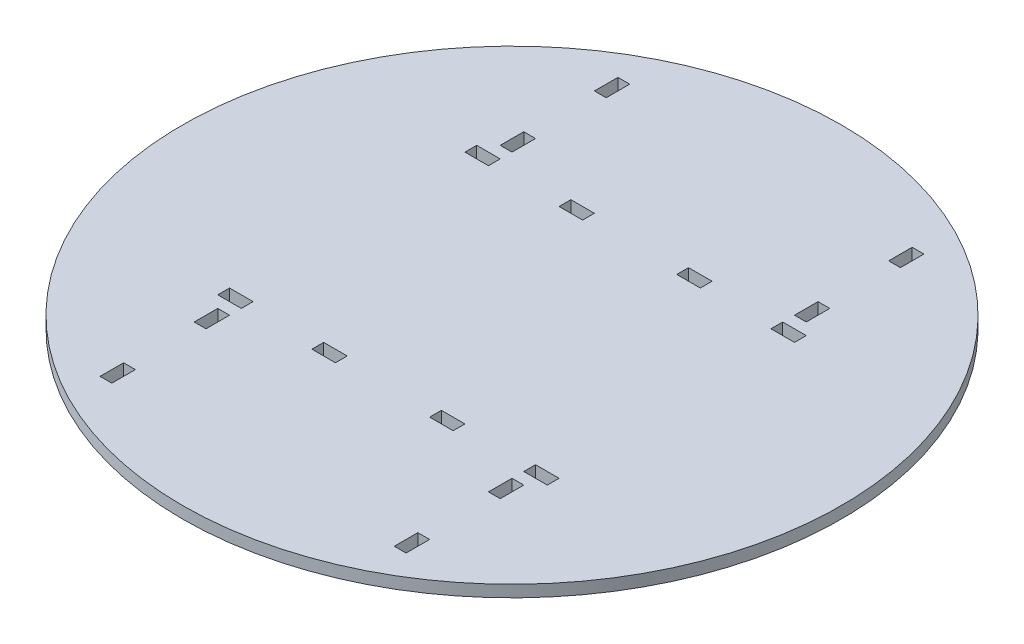
from build123d import *

# Parameters (mm, degrees)
SKETCH1_W           = 6.35
SKETCH1_H           = 12.7
SKETCH1_W_2         = 12.7
SKETCH1_H_2         = 6.35
BOSS_EXTRUDE1_DEPTH = 6.35


with BuildPart() as part:
    # Sketch1 → Boss-Extrude1 (new body)
    # profile 1 of 4: a face of its own
    with BuildSketch(Plane(origin=(0, 0, 0), x_dir=(1, 0, 0), z_dir=(0, 1, 0))):
        with BuildLine():
            Line((0, -177.8), (0, 0))
            Line((0, 0), (-177.8, 0))
            ThreePointArc((-177.8, 0), (-125.723585695, -125.723585695), (0, -177.8))
        make_face()
        with Locations((-79.375, -133.35)):
            Rectangle(SKETCH1_W, SKETCH1_H, mode=Mode.SUBTRACT)
        with Locations((-79.375, -82.55)):
            Rectangle(SKETCH1_W, SKETCH1_H, mode=Mode.SUBTRACT)
        with Locations((-82.55, -66.675)):
            Rectangle(SKETCH1_W_2, SKETCH1_H_2, mode=Mode.SUBTRACT)
        with Locations((-31.75, -66.675)):
            Rectangle(SKETCH1_W_2, SKETCH1_H_2, mode=Mode.SUBTRACT)
    # profile 2 of 4: a face of its own
    with BuildSketch(Plane(origin=(0, 0, 0), x_dir=(1, 0, 0), z_dir=(0, 1, 0))):
        with BuildLine():
            Line((177.8, 0), (0, 0))
            Line((0, 0), (0, -177.8))
            ThreePointArc((0, -177.8), (125.723585695, -125.723585695), (177.8, 0))
        make_face()
        with Locations((79.375, -133.35)):
            Rectangle(SKETCH1_W, SKETCH1_H, mode=Mode.SUBTRACT)
        with Locations((31.75, -66.675)):
            Rectangle(SKETCH1_W_2, SKETCH1_H_2, mode=Mode.SUBTRACT)
        with Locations((79.375, -82.55)):
            Rectangle(SKETCH1_W, SKETCH1_H, mode=Mode.SUBTRACT)
        with Locations((82.55, -66.675)):
            Rectangle(SKETCH1_W_2, SKETCH1_H_2, mode=Mode.SUBTRACT)
    # profile 3 of 4: a face of its own
    with BuildSketch(Plane(origin=(0, 0, 0), x_dir=(1, 0, 0), z_dir=(0, 1, 0))):
        with BuildLine():
            ThreePointArc((177.8, 0), (125.723585695, 125.723585695), (0, 177.8))
            Line((0, 177.8), (0, 0))
            Line((0, 0), (177.8, 0))
        make_face()
        with Locations((31.75, 66.675)):
            Rectangle(SKETCH1_W_2, SKETCH1_H_2, mode=Mode.SUBTRACT)
        with Locations((82.55, 66.675)):
            Rectangle(SKETCH1_W_2, SKETCH1_H_2, mode=Mode.SUBTRACT)
        with Locations((79.375, 82.55)):
            Rectangle(SKETCH1_W, SKETCH1_H, mode=Mode.SUBTRACT)
        with Locations((79.375, 133.35)):
            Rectangle(SKETCH1_W, SKETCH1_H, mode=Mode.SUBTRACT)
    # profile 4 of 4: a face of its own
    with BuildSketch(Plane(origin=(0, 0, 0), x_dir=(1, 0, 0), z_dir=(0, 1, 0))):
        with BuildLine():
            Line((0, 0), (0, 177.8))
            ThreePointArc((0, 177.8), (-125.723585695, 125.723585695), (-177.8, 0))
            Line((-177.8, 0), (0, 0))
        make_face()
        with Locations((-82.55, 66.675)):
            Rectangle(SKETCH1_W_2, SKETCH1_H_2, mode=Mode.SUBTRACT)
        with Locations((-79.375, 82.55)):
            Rectangle(SKETCH1_W, SKETCH1_H, mode=Mode.SUBTRACT)
        with Locations((-31.75, 66.675)):
            Rectangle(SKETCH1_W_2, SKETCH1_H_2, mode=Mode.SUBTRACT)
        with Locations((-79.375, 133.35)):
            Rectangle(SKETCH1_W, SKETCH1_H, mode=Mode.SUBTRACT)
    extrude(amount=BOSS_EXTRUDE1_DEPTH)


solid = part.part
